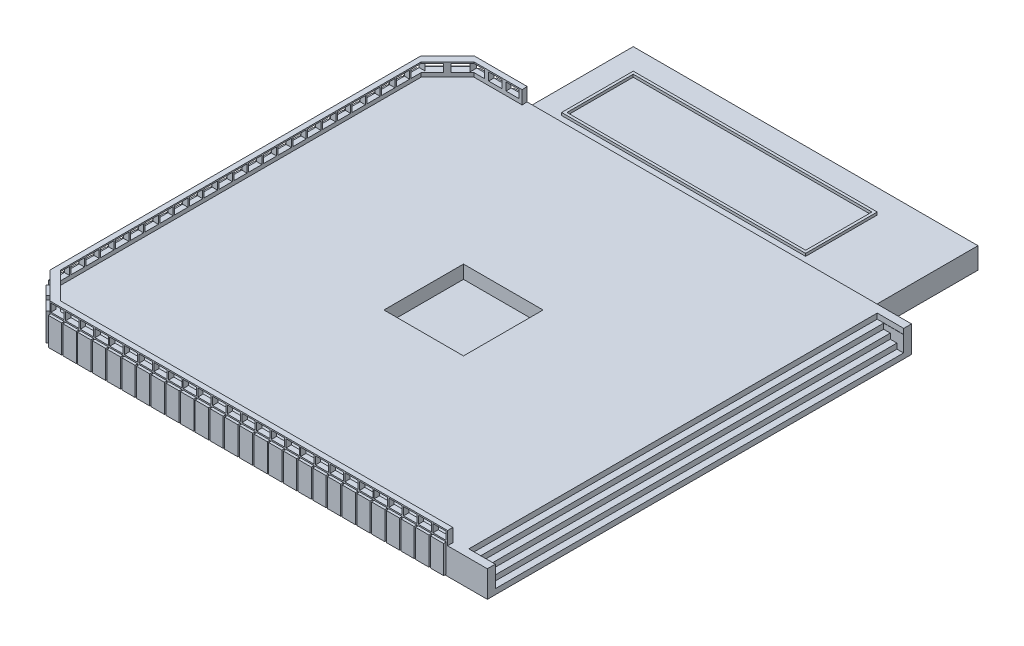
from build123d import *

# Parameters (mm, degrees)
BOSS_EXTRUDE3_DEPTH = 381
CUT_EXTRUDE10_DEPTH = 127
SKETCH24_W          = 3302
SKETCH24_H          = 1018
CUT_EXTRUDE11_DEPTH = 177.8
SKETCH5_W           = 127
SKETCH5_H           = 266.7
BOSS_EXTRUDE4_DEPTH = 25.4
SKETCH6_W           = 127
SKETCH6_H           = 76.2
CUT_EXTRUDE3_DEPTH  = 177.8
LPATTERN1_COUNT     = 27
LPATTERN1_PITCH     = 140.716
LPATTERN2_COUNT     = 27
LPATTERN2_PITCH     = 140.716
SKETCH10_W          = 127
SKETCH10_H          = 266.7
BOSS_EXTRUDE5_DEPTH = 25.4
SKETCH11_W          = 127
SKETCH11_H          = 76.2
CUT_EXTRUDE6_DEPTH  = 5095.267464513
LPATTERN3_COUNT     = 25
LPATTERN3_PITCH     = 141.605
LPATTERN4_COUNT     = 25
LPATTERN4_PITCH     = 141.605
SKETCH13_W          = 127
SKETCH13_H          = 266.7
BOSS_EXTRUDE6_DEPTH = 25.4
SKETCH12_W          = 127
SKETCH12_H          = 76.2
CUT_EXTRUDE7_DEPTH  = 177.8
LPATTERN5_COUNT     = 3
LPATTERN5_PITCH     = 165.1
SKETCH17_W          = 127
SKETCH17_H          = 266.7
BOSS_EXTRUDE7_DEPTH = 25.4
SKETCH20_W          = 127
SKETCH20_H          = 76.2
CUT_EXTRUDE8_DEPTH  = 177.8
LPATTERN7_COUNT     = 2
LPATTERN7_PITCH     = 177.8
SKETCH21_W          = 127
SKETCH21_H          = 266.7
BOSS_EXTRUDE8_DEPTH = 25.4
SKETCH22_W          = 127
SKETCH22_H          = 76.2
CUT_EXTRUDE9_DEPTH  = 177.8
LPATTERN8_COUNT     = 2
LPATTERN8_PITCH     = 177.8
SKETCH25_W          = 2336.8
SKETCH25_H          = 685.8
SKETCH25_W_2        = 2286
SKETCH25_H_2        = 635
EXTRUDE_THIN1_DEPTH = 25.4
BOSS_EXTRUDE9_DEPTH = 381
SKETCH27_W          = 3911.6
SKETCH27_H          = 50.8
CUT_EXTRUDE12_DEPTH = 254
SKETCH29_W          = 3909.6
SKETCH29_H          = 50.8
CUT_EXTRUDE13_DEPTH = 190.5
SKETCH30_W          = 3909.6
SKETCH30_H          = 50.8
CUT_EXTRUDE14_DEPTH = 127
SKETCH31_W          = 3909.6
SKETCH31_H          = 50.8
CUT_EXTRUDE15_DEPTH = 63.5
SKETCH32_W          = 762
SKETCH32_H          = 762
CUT_EXTRUDE16_DEPTH = 127


with BuildPart() as part:
    # Sketch1 → Boss-Extrude3 (new body)
    with BuildSketch(Plane(origin=(0, 0, 0), x_dir=(1, 0, 0), z_dir=(0, 1, 0))):
        Polygon((254, 2032), (0, 1778), (0, -1778), (254, -2032), (4064, -2032), (4064, 3048), (762, 3048), (762, 2032), align=None)
    extrude(amount=BOSS_EXTRUDE3_DEPTH)

    # Sketch3 → Cut-Extrude10 (cut)
    with BuildSketch(Plane(origin=(0, 381, 0), x_dir=(1, 0, 0), z_dir=(0, 1, 0))):
        Polygon((4064, 2030), (3914, 2030), (762.125994018, 2030), (765.200248062, 1981.2), (304.8, 1981.2), (50.8, 1727.2), (50.8, -1727.2), (304.8, -1981.2), (4064, -1981.2), (4064, 1981.2), align=None)
    extrude(amount=-CUT_EXTRUDE10_DEPTH, mode=Mode.SUBTRACT)

    # Sketch24 → Cut-Extrude11 (cut)
    with BuildSketch(Plane(origin=(0, 381, 0), x_dir=(1, 0, 0), z_dir=(0, 1, 0))):
        with Locations((2413, 2539)):
            Rectangle(SKETCH24_W, SKETCH24_H)
    extrude(amount=-CUT_EXTRUDE11_DEPTH, mode=Mode.SUBTRACT)

    # Sketch5 → Boss-Extrude4 (add)
    with BuildSketch(Plane.XY.offset(2032)):
        with Locations((3987.8, 146.05)):
            Rectangle(SKETCH5_W, SKETCH5_H)
    boss_extrude4 = extrude(amount=BOSS_EXTRUDE4_DEPTH)

    # Sketch6 → Cut-Extrude3 (cut)
    with BuildSketch(Plane.XY.offset(2032)):
        with Locations((3987.8, 330.2)):
            Rectangle(SKETCH6_W, SKETCH6_H)
    cut_extrude3 = extrude(amount=-CUT_EXTRUDE3_DEPTH, mode=Mode.SUBTRACT)

    # LPattern1: Boss-Extrude4 ×27
    with Locations(*[(-i * LPATTERN1_PITCH, 0, 0) for i in range(1, LPATTERN1_COUNT)]):
        add(boss_extrude4)

    # LPattern2: Cut-Extrude3 ×27
    with Locations(*[(-i * LPATTERN2_PITCH, 0, 0) for i in range(1, LPATTERN2_COUNT)]):
        add(cut_extrude3, mode=Mode.SUBTRACT)

    # Sketch10 → Boss-Extrude5 (add)
    with BuildSketch(Plane.ZY):
        with Locations((1701.8, 146.05)):
            Rectangle(SKETCH10_W, SKETCH10_H)
    boss_extrude5 = extrude(amount=BOSS_EXTRUDE5_DEPTH)

    # Sketch11 → Cut-Extrude6 (cut, through all)
    with BuildSketch(Plane.ZY):
        with Locations((1701.8, 330.2)):
            Rectangle(SKETCH11_W, SKETCH11_H)
    cut_extrude6 = extrude(amount=-CUT_EXTRUDE6_DEPTH, mode=Mode.SUBTRACT)

    # LPattern3: Cut-Extrude6 ×25
    with Locations(*[(0, 0, -i * LPATTERN3_PITCH) for i in range(1, LPATTERN3_COUNT)]):
        add(cut_extrude6, mode=Mode.SUBTRACT)

    # LPattern4: Boss-Extrude5 ×25
    with Locations(*[(0, 0, -i * LPATTERN4_PITCH) for i in range(1, LPATTERN4_COUNT)]):
        add(boss_extrude5)

    # Sketch13 → Boss-Extrude6 (add)
    with BuildSketch(Plane(origin=(0, 0, -2032), x_dir=(-1, 0, 0), z_dir=(0, 0, -1))):
        with Locations((-342.9, 146.05)):
            Rectangle(SKETCH13_W, SKETCH13_H)
    boss_extrude6 = extrude(amount=BOSS_EXTRUDE6_DEPTH)

    # Sketch12 → Cut-Extrude7 (cut)
    with BuildSketch(Plane(origin=(0, 0, -2032), x_dir=(-1, 0, 0), z_dir=(0, 0, -1))):
        with Locations((-342.9, 330.2)):
            Rectangle(SKETCH12_W, SKETCH12_H)
    cut_extrude7 = extrude(amount=-CUT_EXTRUDE7_DEPTH, mode=Mode.SUBTRACT)

    # LPattern5: Boss-Extrude6, Cut-Extrude7 ×3
    with Locations(*[(i * LPATTERN5_PITCH, 0, 0) for i in range(1, LPATTERN5_COUNT)]):
        add(boss_extrude6)
        add(cut_extrude7, mode=Mode.SUBTRACT)

    # Sketch17 → Boss-Extrude7 (add)
    with BuildSketch(Plane(origin=(-889, 0, 889), x_dir=(0.7071067811865477, 0, 0.7071067811865475), z_dir=(-0.7071067811865475, 0, 0.7071067811865477))):
        with Locations((1527.546101792, 146.05)):
            Rectangle(SKETCH17_W, SKETCH17_H)
    boss_extrude7 = extrude(amount=BOSS_EXTRUDE7_DEPTH)

    # Sketch20 → Cut-Extrude8 (cut)
    with BuildSketch(Plane(origin=(-889, 0, 889), x_dir=(0.7071067811865477, 0, 0.7071067811865475), z_dir=(-0.7071067811865475, 0, 0.7071067811865477))):
        with Locations((1527.546101792, 330.2)):
            Rectangle(SKETCH20_W, SKETCH20_H)
    cut_extrude8 = extrude(amount=-CUT_EXTRUDE8_DEPTH, mode=Mode.SUBTRACT)

    # LPattern7: Boss-Extrude7, Cut-Extrude8 ×2
    with Locations(*[Vector(-0.7071067811865476, 0, -0.7071067811865476) * (i * LPATTERN7_PITCH) for i in range(1, LPATTERN7_COUNT)]):
        add(boss_extrude7)
        add(cut_extrude8, mode=Mode.SUBTRACT)

    # Sketch21 → Boss-Extrude8 (add)
    with BuildSketch(Plane(origin=(-889, 0, -889), x_dir=(-0.7071067811865476, 0, 0.7071067811865475), z_dir=(-0.7071067811865475, 0, -0.7071067811865476))):
        with Locations((-1346.13585695, 146.05)):
            Rectangle(SKETCH21_W, SKETCH21_H)
    boss_extrude8 = extrude(amount=BOSS_EXTRUDE8_DEPTH)

    # Sketch22 → Cut-Extrude9 (cut)
    with BuildSketch(Plane(origin=(-889, 0, -889), x_dir=(-0.7071067811865476, 0, 0.7071067811865475), z_dir=(-0.7071067811865475, 0, -0.7071067811865476))):
        with Locations((-1346.13585695, 330.2)):
            Rectangle(SKETCH22_W, SKETCH22_H)
    cut_extrude9 = extrude(amount=-CUT_EXTRUDE9_DEPTH, mode=Mode.SUBTRACT)

    # LPattern8: Boss-Extrude8, Cut-Extrude9 ×2
    with Locations(*[Vector(0.7071067811865475, 0, -0.7071067811865476) * (i * LPATTERN8_PITCH) for i in range(1, LPATTERN8_COUNT)]):
        add(boss_extrude8)
        add(cut_extrude9, mode=Mode.SUBTRACT)

    # Sketch25 → Extrude-Thin1 (add)
    with BuildSketch(Plane(origin=(0, 203.2, 0), x_dir=(1, 0, 0), z_dir=(0, 1, 0))):
        with Locations((2159, 2476.5)):
            Rectangle(SKETCH25_W, SKETCH25_H)
        with Locations((2159, 2476.5)):
            Rectangle(SKETCH25_W_2, SKETCH25_H_2, mode=Mode.SUBTRACT)
    extrude(amount=EXTRUDE_THIN1_DEPTH)

    # Sketch26 → Boss-Extrude9 (add)
    with BuildSketch(Plane(origin=(4064, 0, 0), x_dir=(0, 0, -1), z_dir=(1, 0, 0))):
        Polygon((0, 0), (-2032, 0), (-2032, 254), (2030, 254), (2032, 0), align=None)
    extrude(amount=BOSS_EXTRUDE9_DEPTH)

    # Sketch27 → Cut-Extrude12 (cut)
    with BuildSketch(Plane(origin=(4445, 0, 0), x_dir=(0, 0, -1), z_dir=(1, 0, 0))):
        with Locations((0, 228.6)):
            Rectangle(SKETCH27_W, SKETCH27_H)
    extrude(amount=-CUT_EXTRUDE12_DEPTH, mode=Mode.SUBTRACT)

    # Sketch29 → Cut-Extrude13 (cut)
    with BuildSketch(Plane(origin=(4445, 0, 0), x_dir=(0, 0, -1), z_dir=(1, 0, 0))):
        with Locations((-1, 177.8)):
            Rectangle(SKETCH29_W, SKETCH29_H)
    extrude(amount=-CUT_EXTRUDE13_DEPTH, mode=Mode.SUBTRACT)

    # Sketch30 → Cut-Extrude14 (cut)
    with BuildSketch(Plane(origin=(4445, 0, 0), x_dir=(0, 0, -1), z_dir=(1, 0, 0))):
        with Locations((-1, 127)):
            Rectangle(SKETCH30_W, SKETCH30_H)
    extrude(amount=-CUT_EXTRUDE14_DEPTH, mode=Mode.SUBTRACT)

    # Sketch31 → Cut-Extrude15 (cut)
    with BuildSketch(Plane(origin=(4445, 0, 0), x_dir=(0, 0, -1), z_dir=(1, 0, 0))):
        with Locations((-1, 76.2)):
            Rectangle(SKETCH31_W, SKETCH31_H)
    extrude(amount=-CUT_EXTRUDE15_DEPTH, mode=Mode.SUBTRACT)

    # Sketch32 → Cut-Extrude16 (cut)
    with BuildSketch(Plane(origin=(0, 254, 0), x_dir=(1, 0, 0), z_dir=(0, 1, 0))):
        with Locations((2184.4, 0)):
            Rectangle(SKETCH32_W, SKETCH32_H)
    extrude(amount=-CUT_EXTRUDE16_DEPTH, mode=Mode.SUBTRACT)


solid = part.part
